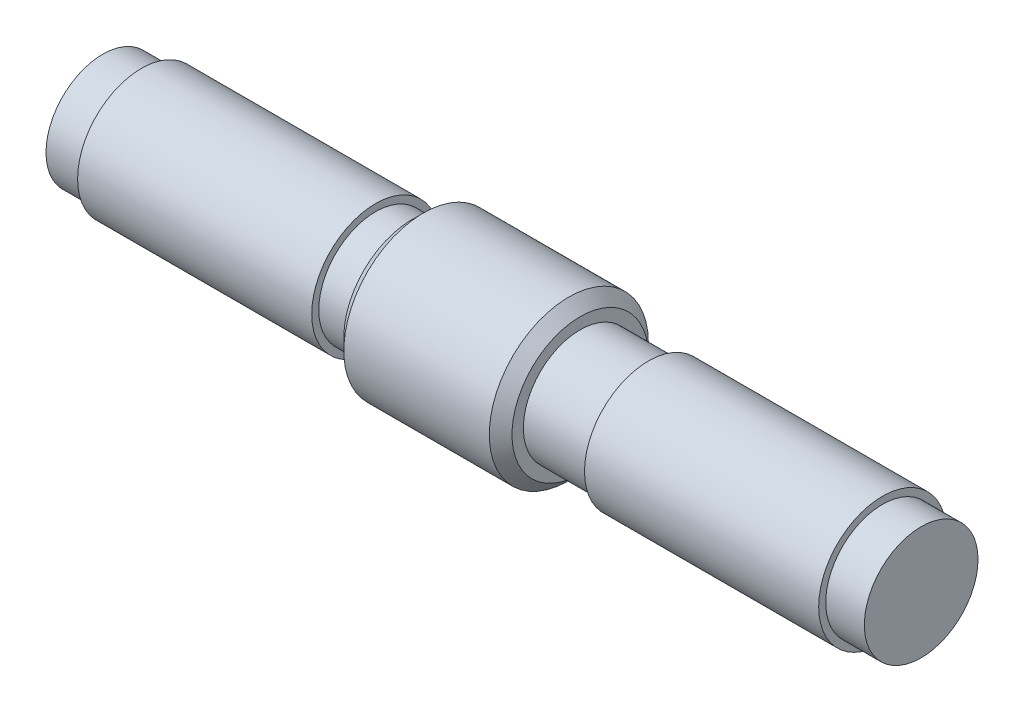
from build123d import *

# Parameters (mm, degrees)
CROQUIS1_R              = 35
SALIENTE_EXTRUIR1_DEPTH = 37
CHAFL_N1_SIZE           = 5
CROQUIS2_R              = 25
SALIENTE_EXTRUIR2_DEPTH = 16
CROQUIS3_R              = 28.1
SALIENTE_EXTRUIR3_DEPTH = 120
SALIENTE_EXTRUIR4_START = 30
CROQUIS4_R              = 25
SALIENTE_EXTRUIR4_DEPTH = 30
SALIENTE_EXTRUIR5_START = 120
CROQUIS5_R              = 28.1
SALIENTE_EXTRUIR5_DEPTH = 120
CORTAR_EXTRUIR1_START   = -17
CROQUIS6_R              = 28.1
CROQUIS6_R_2            = 25
CORTAR_EXTRUIR1_DEPTH   = 17
CROQUIS8_R              = 28.1
CROQUIS8_R_2            = 25
CORTAR_EXTRUIR2_DEPTH   = 17


with BuildPart() as part:
    # Croquis1 → Saliente-Extruir1 (new, symmetric)
    with BuildSketch(Plane(origin=(0, 0, 0), x_dir=(0, 0, -1), z_dir=(1, 0, 0))):
        Circle(CROQUIS1_R)
    extrude(amount=SALIENTE_EXTRUIR1_DEPTH, both=True)

    # Chaflán1
    chafl_n1_edges = [part.edges().sort_by_distance(p)[0] for p in [
        (37, 0, 35),
        (-37, 0, 35),
    ]]
    chamfer(chafl_n1_edges, length=CHAFL_N1_SIZE)

    # Croquis2 → Saliente-Extruir2 (add)
    with BuildSketch(Plane.ZY.offset(37)):
        Circle(CROQUIS2_R)
    extrude(amount=SALIENTE_EXTRUIR2_DEPTH)

    # Croquis3 → Saliente-Extruir3 (add)
    with BuildSketch(Plane.ZY.offset(53)):
        Circle(CROQUIS3_R)
    extrude(amount=SALIENTE_EXTRUIR3_DEPTH)

    # Croquis4 → Saliente-Extruir4 (add)
    with BuildSketch(Plane(origin=(37, 0, 0), x_dir=(0, 0, -1), z_dir=(1, 0, 0)).offset(SALIENTE_EXTRUIR4_START)):
        Circle(CROQUIS4_R)
    extrude(amount=-SALIENTE_EXTRUIR4_DEPTH)

    # Croquis5 → Saliente-Extruir5 (add)
    with BuildSketch(Plane(origin=(67, 0, 0), x_dir=(0, 0, -1), z_dir=(1, 0, 0)).offset(SALIENTE_EXTRUIR5_START)):
        Circle(CROQUIS5_R)
    extrude(amount=-SALIENTE_EXTRUIR5_DEPTH)

    # Croquis6 → Cortar-Extruir1 (cut)
    with BuildSketch(Plane.ZY.offset(173).offset(CORTAR_EXTRUIR1_START)):
        Circle(CROQUIS6_R)
        Circle(CROQUIS6_R_2, mode=Mode.SUBTRACT)
    extrude(amount=CORTAR_EXTRUIR1_DEPTH, mode=Mode.SUBTRACT)

    # Croquis8 → Cortar-Extruir2 (cut)
    with BuildSketch(Plane(origin=(187, 0, 0), x_dir=(0, 0, -1), z_dir=(1, 0, 0))):
        Circle(CROQUIS8_R)
        Circle(CROQUIS8_R_2, mode=Mode.SUBTRACT)
    extrude(amount=-CORTAR_EXTRUIR2_DEPTH, mode=Mode.SUBTRACT)


solid = part.part
